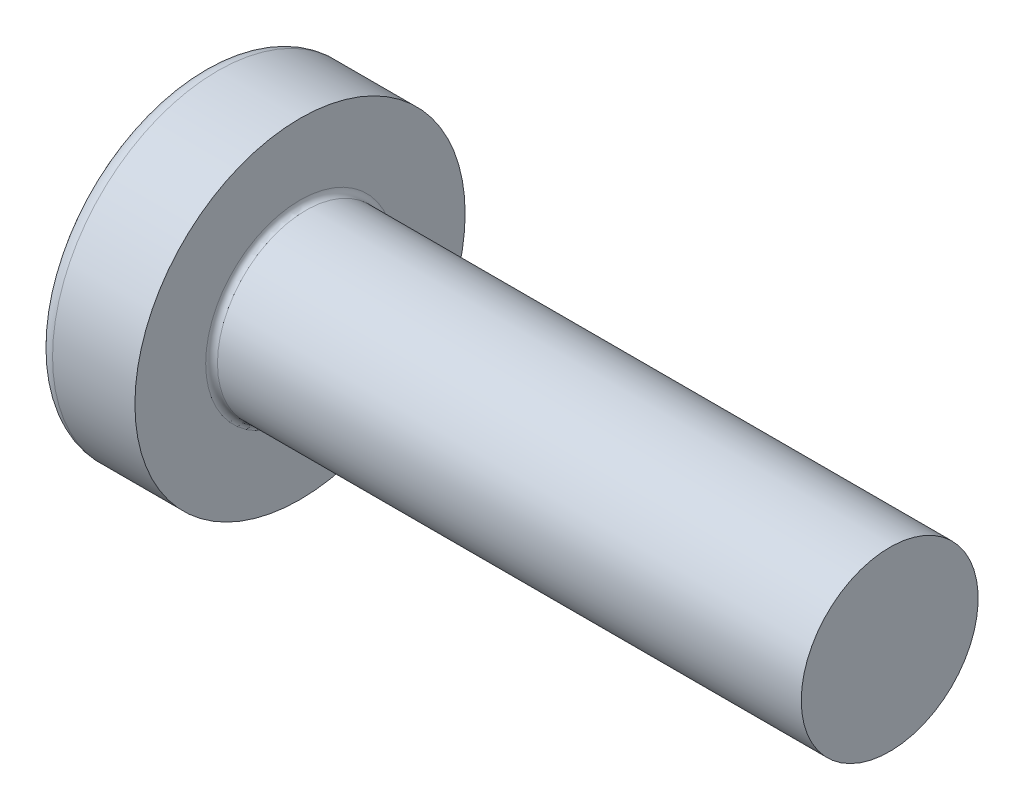
from build123d import *

# Parameters (mm, degrees)
RECPAT_COUNT = 2
RECPAT_ANGLE = 90


with BuildPart() as part:
    # Fillet1: read off the stored shape, not the designer's step
    # Fillet1 outline → Fillet1 (revolve)
    with BuildSketch(Plane.YX):
        with BuildLine():
            Line((1.5, 2.5), (1.5, 12.4))
            Line((1.5, 12.4), (0, 12.4))
            Line((0, 12.4), (0, 0))
            ThreePointArc((0, 0), (1.392274758, 0.197753547), (2.674418607, 0.775371601))
            ThreePointArc((2.674418607, 0.775371601), (2.76653015, 0.873295971), (2.8, 1.003501533))
            Line((2.8, 1.003501533), (2.8, 2.4))
            Line((2.8, 2.4), (1.6, 2.4))
            ThreePointArc((1.6, 2.4), (1.529289322, 2.429289322), (1.5, 2.5))
        make_face()
    revolve(axis=Axis((0, 0, 0), (1, 0, 0)))

    # Sketch3 → Recess section 0
    with BuildSketch(Plane(origin=(0, 0, 0), x_dir=(0, 0, -1), z_dir=(1, 0, 0))):
        with BuildLine():
            Line((0.37, -1.4), (-0.37, -1.4))
            Line((-0.37, -1.4), (-0.37, 1.4))
            Line((-0.37, 1.4), (0.37, 1.4))
            Line((0.37, 1.4), (0.37, -1.4))
        make_face()
    # Sketch4 → Recess section 1
    with BuildSketch(Plane(origin=(1.75, 0, 0), x_dir=(0, 0, -1), z_dir=(1, 0, 0))):
        with BuildLine():
            Line((0.37, -0.527482332), (-0.37, -0.527482332))
            Line((-0.37, -0.527482332), (-0.37, 0.527482332))
            Line((-0.37, 0.527482332), (0.37, 0.527482332))
            Line((0.37, 0.527482332), (0.37, -0.527482332))
        make_face()
    recess = loft(mode=Mode.SUBTRACT)

    # RecPat: Recess ×2 about axis
    recpat_axis = Axis((0, 0, 0), (1, 0, 0))
    for i in range(1, RECPAT_COUNT):
        add(recess.rotate(recpat_axis, i * RECPAT_ANGLE / (RECPAT_COUNT - 1)), mode=Mode.SUBTRACT)

    # RecCorSke → RecessCore (revolve, cut)
    with BuildSketch(Plane.XY, mode=Mode.PRIVATE) as recesscore_sk:
        Polygon((0, 0), (0, 0.678371921), (1.75, 0.556), (1.930655351, 0), align=None)
    revolve(recesscore_sk.sketch.rotate(Axis((-3.175, 0, 0), (1, 0, 0)), 90), axis=Axis((-3.175, 0, 0), (1, 0, 0)), mode=Mode.SUBTRACT)


solid = part.part
